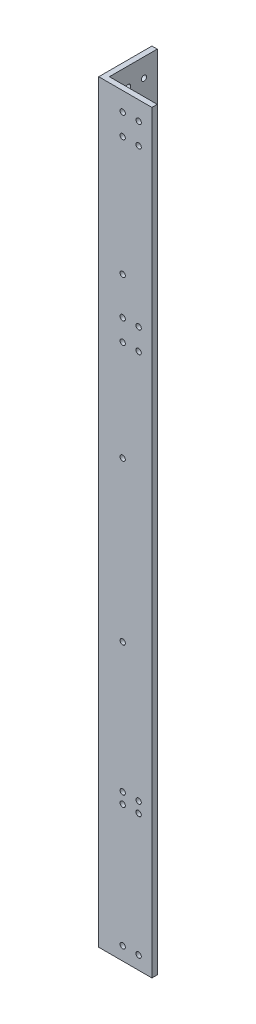
from build123d import *

# Parameters (mm, degrees)
BOSS_EXTRUDE1_DEPTH               = 450
RIGHTSIDEHOLES_SKETCH3_R          = 1.5875
RIGHTSIDEHOLES_CUT_EXTRUDE1_DEPTH = 3.175
FRONTSIDEHOLES_SKETCH4_R          = 1.5875
FRONTSIDEHOLES_CUT_EXTRUDE2_DEPTH = 3.175


with BuildPart() as part:
    # Sketch2 → Boss-Extrude1 (new body)
    with BuildSketch(Plane(origin=(0, 0, 0), x_dir=(1, 0, 0), z_dir=(0, 1, 0))):
        Polygon((0, 31.75), (3.175, 31.75), (3.175, 3.175), (31.75, 3.175), (31.75, 0), (0, 0), align=None)
    extrude(amount=BOSS_EXTRUDE1_DEPTH)

    # RightSideHoles-Sketch3 → RightSideHoles-Cut-Extrude1 (cut)
    with BuildSketch(Plane.XY):
        with Locations((14.2875, 81.1125)):
            Circle(RIGHTSIDEHOLES_SKETCH3_R)
        with Locations((23.8125, 81.1125)):
            Circle(RIGHTSIDEHOLES_SKETCH3_R)
        with Locations((14.2875, 87.4625)):
            Circle(RIGHTSIDEHOLES_SKETCH3_R)
        with Locations((23.8125, 87.4625)):
            Circle(RIGHTSIDEHOLES_SKETCH3_R)
        with Locations((14.2875, 438.8875)):
            Circle(RIGHTSIDEHOLES_SKETCH3_R)
        with Locations((14.2875, 426.1875)):
            Circle(RIGHTSIDEHOLES_SKETCH3_R)
        with Locations((23.8125, 438.8875)):
            Circle(RIGHTSIDEHOLES_SKETCH3_R)
        with Locations((23.8125, 426.1875)):
            Circle(RIGHTSIDEHOLES_SKETCH3_R)
        with Locations((14.2875, 332.602644)):
            Circle(RIGHTSIDEHOLES_SKETCH3_R)
        with Locations((23.8125, 332.602644)):
            Circle(RIGHTSIDEHOLES_SKETCH3_R)
        with Locations((14.2875, 319.902644)):
            Circle(RIGHTSIDEHOLES_SKETCH3_R)
        with Locations((23.8125, 319.902644)):
            Circle(RIGHTSIDEHOLES_SKETCH3_R)
        with Locations((14.2875, 7.9375)):
            Circle(RIGHTSIDEHOLES_SKETCH3_R)
        with Locations((23.8125, 7.9375)):
            Circle(RIGHTSIDEHOLES_SKETCH3_R)
        with Locations((14.2875, 165)):
            Circle(RIGHTSIDEHOLES_SKETCH3_R)
        with Locations((14.2875, 260)):
            Circle(RIGHTSIDEHOLES_SKETCH3_R)
        with Locations((14.2875, 355)):
            Circle(RIGHTSIDEHOLES_SKETCH3_R)
    extrude(amount=-RIGHTSIDEHOLES_CUT_EXTRUDE1_DEPTH, mode=Mode.SUBTRACT)

    # FrontSideHoles-Sketch4 → FrontSideHoles-Cut-Extrude2 (cut)
    with BuildSketch(Plane.ZY):
        with Locations((-23.8125, 81.1125)):
            Circle(FRONTSIDEHOLES_SKETCH4_R)
        with Locations((-14.2875, 81.1125)):
            Circle(FRONTSIDEHOLES_SKETCH4_R)
        with Locations((-23.8125, 87.4625)):
            Circle(FRONTSIDEHOLES_SKETCH4_R)
        with Locations((-14.2875, 87.4625)):
            Circle(FRONTSIDEHOLES_SKETCH4_R)
        with Locations((-23.8125, 438.8875)):
            Circle(FRONTSIDEHOLES_SKETCH4_R)
        with Locations((-14.2875, 438.8875)):
            Circle(FRONTSIDEHOLES_SKETCH4_R)
        with Locations((-23.8125, 426.1875)):
            Circle(FRONTSIDEHOLES_SKETCH4_R)
        with Locations((-14.2875, 426.1875)):
            Circle(FRONTSIDEHOLES_SKETCH4_R)
        with Locations((-14.2875, 338.177644)):
            Circle(FRONTSIDEHOLES_SKETCH4_R)
        with Locations((-14.2875, 319.652644)):
            Circle(FRONTSIDEHOLES_SKETCH4_R)
        with Locations((-14.2875, 165)):
            Circle(FRONTSIDEHOLES_SKETCH4_R)
        with Locations((-14.2875, 260)):
            Circle(FRONTSIDEHOLES_SKETCH4_R)
        with Locations((-14.2875, 355)):
            Circle(FRONTSIDEHOLES_SKETCH4_R)
        with Locations((-23.8125, 7.9375)):
            Circle(FRONTSIDEHOLES_SKETCH4_R)
        with Locations((-14.2875, 7.9375)):
            Circle(FRONTSIDEHOLES_SKETCH4_R)
    extrude(amount=-FRONTSIDEHOLES_CUT_EXTRUDE2_DEPTH, mode=Mode.SUBTRACT)


solid = part.part
